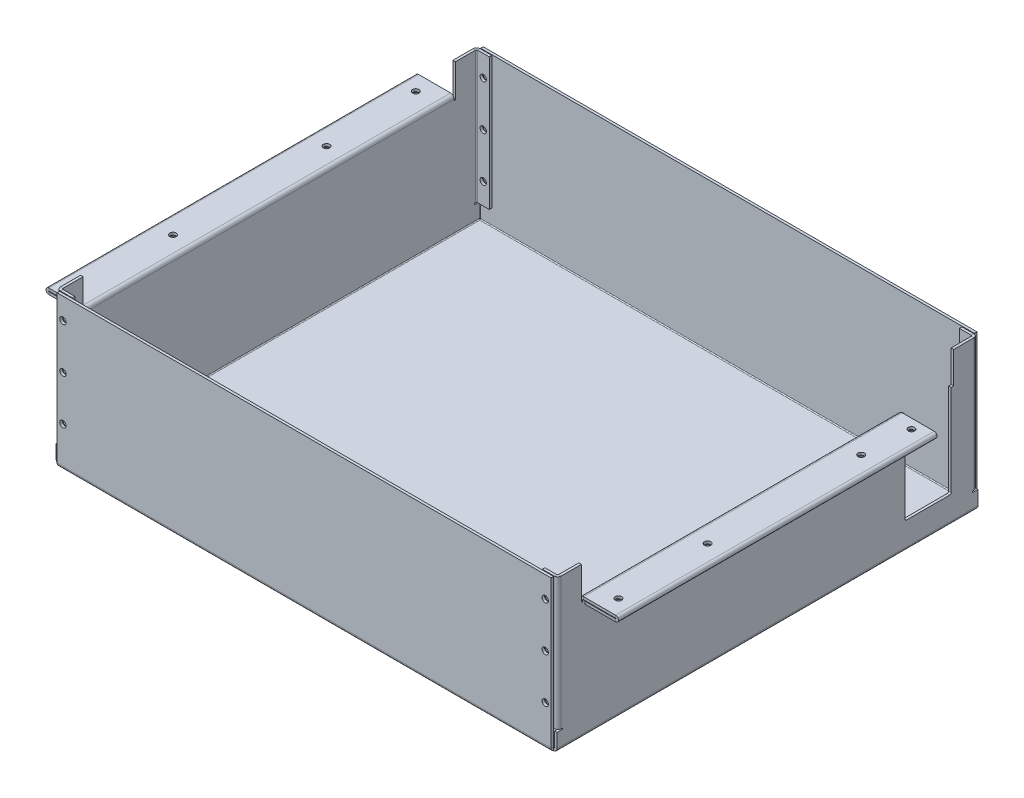
from build123d import *

# Parameters (mm, degrees)
SKETCH3_W                        = 329
SKETCH3_H                        = 116
BASE_FLANGE1_DEPTH               = 2
EDGE_FLANGE2_STRIP_W             = 9.4732
EDGE_FLANGE2_STRIP_H             = 2
EDGE_FLANGE2_STRIP_CUT_DEPTH     = 329
EDGE_FLANGE2_DEPTH               = 329
EDGE_FLANGE3_STRIP_W             = 9.4732
EDGE_FLANGE3_STRIP_H             = 2
EDGE_FLANGE3_STRIP_CUT_DEPTH     = 329
EDGE_FLANGE3_DEPTH               = 329
EDGE_FLANGE5_STRIP_W             = 9.4732
EDGE_FLANGE5_STRIP_H             = 2
EDGE_FLANGE5_STRIP_CUT_DEPTH     = 385.9268
EDGE_FLANGE5_DEPTH               = 385.9268
EDGE_FLANGE10_STRIP_W            = 9.9732
EDGE_FLANGE10_STRIP_H            = 2
EDGE_FLANGE10_STRIP_CUT_DEPTH    = 103.2634
EDGE_FLANGE10_RELIEF_W           = 10.9732
EDGE_FLANGE10_RELIEF_H           = 1
EDGE_FLANGE10_RELIEF_CUT_DEPTH   = 2
EDGE_FLANGE10_DEPTH              = 103.2634
EDGE_FLANGE11_STRIP_W            = 9.9732
EDGE_FLANGE11_STRIP_H            = 2
EDGE_FLANGE11_STRIP_CUT_DEPTH    = 103.2634
EDGE_FLANGE11_RELIEF_W           = 10.9732
EDGE_FLANGE11_RELIEF_H           = 1
EDGE_FLANGE11_RELIEF_CUT_DEPTH   = 2
EDGE_FLANGE11_DEPTH              = 103.2634
EDGE_FLANGE13_STRIP_W            = 31.4732
EDGE_FLANGE13_STRIP_H            = 2
EDGE_FLANGE13_STRIP_CUT_DEPTH    = 289
EDGE_FLANGE13_RELIEF_W           = 32.4732
EDGE_FLANGE13_RELIEF_H           = 1
EDGE_FLANGE13_RELIEF_CUT_DEPTH   = 2
EDGE_FLANGE13_STRIP_2_W          = 31.4732
EDGE_FLANGE13_STRIP_2_H          = 2
EDGE_FLANGE13_STRIP_CUT_2_DEPTH  = 249
EDGE_FLANGE13_RELIEF_2_W         = 32.4732
EDGE_FLANGE13_RELIEF_2_H         = 1
EDGE_FLANGE13_RELIEF_CUT_2_DEPTH = 2
EDGE_FLANGE13_DEPTH              = 289
EDGE_FLANGE13_BEND_DEPTH         = 249
HEM1_START                       = -144.5
HEM1_DEPTH                       = 289
HEM1_START_2                     = -104.5
HEM1_2_DEPTH                     = 249
HEM1_3_DEPTH                     = 40
SKETCH72_R                       = 2.5
CUT_EXTRUDE2_DEPTH               = 313.334260048
SKETCH73_R                       = 2.5
CUT_EXTRUDE3_DEPTH               = 313.334260048
SKETCH78_W                       = 40
SKETCH78_H                       = 24.7366
CUT_EXTRUDE4_DEPTH               = 10
CUT_EXTRUDE5_DEPTH               = 10
SKETCH80_R                       = 2.5
CUT_EXTRUDE7_DEPTH               = 419.45362945


# Read off the part's stored shape, not the designer's step: Hem1
# Sheet-metal steps are written as plain solids
with BuildPart() as part:
    # Sketch3 → Base-Flange1 (new body)
    with BuildSketch(Plane(origin=(-171.2, 0, 0), x_dir=(0, 0, -1), z_dir=(1, 0, 0))):
        Rectangle(SKETCH3_W, SKETCH3_H)
    extrude(amount=-BASE_FLANGE1_DEPTH)

    # Edge-Flange2 strip (across the edge) → Edge-Flange2 strip cut (cut)
    with BuildSketch(Plane(origin=(-171.2, -58, 164.5), x_dir=(0, 1, 0), z_dir=(0, 0, -1))):
        with Locations((-4, -1)):
            Rectangle(EDGE_FLANGE2_STRIP_W, EDGE_FLANGE2_STRIP_H)
    extrude(amount=EDGE_FLANGE2_STRIP_CUT_DEPTH, mode=Mode.SUBTRACT)

    # Edge-Flange2 section (across the edge) → Edge-Flange2 (add)
    with BuildSketch(Plane(origin=(-171.2, -58, 164.5), x_dir=(0, 1, 0), z_dir=(0, 0, -1))):
        with BuildLine():
            Line((-2, 0.7366), (-2, 387.4))
            Line((-2, 387.4), (0, 387.4))
            Line((0, 387.4), (0, 0.7366))
            ThreePointArc((0, 0.7366), (0.215745145, 0.215745145), (0.7366, 0))
            Line((0.7366, 0), (0.7366, -2))
            ThreePointArc((0.7366, -2), (-1.198468417, -1.198468417), (-2, 0.7366))
        make_face()
    extrude(amount=EDGE_FLANGE2_DEPTH)

    # Edge-Flange3 strip (across the edge) → Edge-Flange3 strip cut (cut)
    with BuildSketch(Plane(origin=(216.2, -58, 164.5), x_dir=(-1, 0, 0), z_dir=(0, 0, -1))):
        with Locations((-4, -1)):
            Rectangle(EDGE_FLANGE3_STRIP_W, EDGE_FLANGE3_STRIP_H)
    extrude(amount=EDGE_FLANGE3_STRIP_CUT_DEPTH, mode=Mode.SUBTRACT)

    # Edge-Flange3 section (across the edge) → Edge-Flange3 (add)
    with BuildSketch(Plane(origin=(216.2, -58, 164.5), x_dir=(-1, 0, 0), z_dir=(0, 0, -1))):
        with BuildLine():
            Line((-2, 0.7366), (-2, 116))
            Line((-2, 116), (0, 116))
            Line((0, 116), (0, 0.7366))
            ThreePointArc((0, 0.7366), (0.215745145, 0.215745145), (0.7366, 0))
            Line((0.7366, 0), (0.7366, -2))
            ThreePointArc((0.7366, -2), (-1.198468417, -1.198468417), (-2, 0.7366))
        make_face()
    extrude(amount=EDGE_FLANGE3_DEPTH)

    # Edge-Flange5 strip (across the edge) → Edge-Flange5 strip cut (cut)
    with BuildSketch(Plane(origin=(-170.4634, -58, 164.5), x_dir=(0, 0, -1), z_dir=(1, 0, 0))):
        with Locations((-4, -1)):
            Rectangle(EDGE_FLANGE5_STRIP_W, EDGE_FLANGE5_STRIP_H)
    edge_flange5_strip_cut = extrude(amount=EDGE_FLANGE5_STRIP_CUT_DEPTH, mode=Mode.SUBTRACT)

    # Edge-Flange5 section (across the edge) → Edge-Flange5 (add)
    with BuildSketch(Plane(origin=(-170.4634, -58, 164.5), x_dir=(0, 0, -1), z_dir=(1, 0, 0))):
        with BuildLine():
            Line((-2, 0.7366), (-2, 116))
            Line((-2, 116), (0, 116))
            Line((0, 116), (0, 0.7366))
            ThreePointArc((0, 0.7366), (0.215745145, 0.215745145), (0.7366, 0))
            Line((0.7366, 0), (0.7366, -2))
            ThreePointArc((0.7366, -2), (-1.198468417, -1.198468417), (-2, 0.7366))
        make_face()
    edge_flange5 = extrude(amount=EDGE_FLANGE5_DEPTH)

    # Mirror1: Edge-Flange5 strip cut, Edge-Flange5 across plane
    add(edge_flange5_strip_cut.mirror(Plane.XY), mode=Mode.SUBTRACT)
    add(edge_flange5.mirror(Plane.XY))

    # Edge-Flange10 strip (across the edge) → Edge-Flange10 strip cut (cut)
    with BuildSketch(Plane(origin=(216.2, -45.2634, 164), x_dir=(0, 0, -1), z_dir=(0, 1, 0))):
        with Locations((-2.25, -1)):
            Rectangle(EDGE_FLANGE10_STRIP_W, EDGE_FLANGE10_STRIP_H)
    edge_flange10_strip_cut = extrude(amount=EDGE_FLANGE10_STRIP_CUT_DEPTH, mode=Mode.SUBTRACT)

    # Edge-Flange10 relief (on the sheet) → Edge-Flange10 relief cut (cut)
    with BuildSketch(Plane(origin=(216.2, -45.2634, 161.2634), x_dir=(0, 0, -1), z_dir=(-1, 0, 0))):
        with Locations((-4.4866, 0.5)):
            Rectangle(EDGE_FLANGE10_RELIEF_W, EDGE_FLANGE10_RELIEF_H)
    edge_flange10_relief_cut = extrude(amount=-EDGE_FLANGE10_RELIEF_CUT_DEPTH, mode=Mode.SUBTRACT)

    # Edge-Flange10 section (across the edge) → Edge-Flange10 (add)
    with BuildSketch(Plane(origin=(216.2, -45.2634, 164), x_dir=(0, 0, -1), z_dir=(0, 1, 0))):
        with BuildLine():
            Line((0, 0.7366), (0, 10))
            Line((0, 10), (2, 10))
            Line((2, 10), (2, 0.7366))
            ThreePointArc((2, 0.7366), (2.215745145, 0.215745145), (2.7366, 0))
            Line((2.7366, 0), (2.7366, -2))
            ThreePointArc((2.7366, -2), (0.801531583, -1.198468417), (0, 0.7366))
        make_face()
    edge_flange10 = extrude(amount=EDGE_FLANGE10_DEPTH)

    # Mirror3: Edge-Flange10 strip cut, Edge-Flange10 relief cut, Edge-Flange10 across plane
    add(edge_flange10_strip_cut.mirror(Plane.XY), mode=Mode.SUBTRACT)
    add(edge_flange10_relief_cut.mirror(Plane.XY), mode=Mode.SUBTRACT)
    add(edge_flange10.mirror(Plane.XY))

    # Edge-Flange11 strip (across the edge) → Edge-Flange11 strip cut (cut)
    with BuildSketch(Plane(origin=(-171.2, -45.2634, -164), x_dir=(0, 0, 1), z_dir=(0, 1, 0))):
        with Locations((-2.25, -1)):
            Rectangle(EDGE_FLANGE11_STRIP_W, EDGE_FLANGE11_STRIP_H)
    edge_flange11_strip_cut = extrude(amount=EDGE_FLANGE11_STRIP_CUT_DEPTH, mode=Mode.SUBTRACT)

    # Edge-Flange11 relief (on the sheet) → Edge-Flange11 relief cut (cut)
    with BuildSketch(Plane(origin=(-171.2, -45.2634, -161.2634), x_dir=(0, 0, 1), z_dir=(1, 0, 0))):
        with Locations((-4.4866, 0.5)):
            Rectangle(EDGE_FLANGE11_RELIEF_W, EDGE_FLANGE11_RELIEF_H)
    edge_flange11_relief_cut = extrude(amount=-EDGE_FLANGE11_RELIEF_CUT_DEPTH, mode=Mode.SUBTRACT)

    # Edge-Flange11 section (across the edge) → Edge-Flange11 (add)
    with BuildSketch(Plane(origin=(-171.2, -45.2634, -164), x_dir=(0, 0, 1), z_dir=(0, 1, 0))):
        with BuildLine():
            Line((0, 0.7366), (0, 10))
            Line((0, 10), (2, 10))
            Line((2, 10), (2, 0.7366))
            ThreePointArc((2, 0.7366), (2.215745145, 0.215745145), (2.7366, 0))
            Line((2.7366, 0), (2.7366, -2))
            ThreePointArc((2.7366, -2), (0.801531583, -1.198468417), (0, 0.7366))
        make_face()
    edge_flange11 = extrude(amount=EDGE_FLANGE11_DEPTH)

    # Mirror4: Edge-Flange11 strip cut, Edge-Flange11 relief cut, Edge-Flange11 across plane
    add(edge_flange11_strip_cut.mirror(Plane.XY), mode=Mode.SUBTRACT)
    add(edge_flange11_relief_cut.mirror(Plane.XY), mode=Mode.SUBTRACT)
    add(edge_flange11.mirror(Plane.XY))

    # Edge-Flange13 strip (across the edge) → Edge-Flange13 strip cut (cut)
    with BuildSketch(Plane(origin=(-173.2, 36, 144.5), x_dir=(0, -1, 0), z_dir=(0, 0, -1))):
        with Locations((-13, -1)):
            Rectangle(EDGE_FLANGE13_STRIP_W, EDGE_FLANGE13_STRIP_H)
    extrude(amount=EDGE_FLANGE13_STRIP_CUT_DEPTH, mode=Mode.SUBTRACT)

    # Edge-Flange13 relief (on the sheet) → Edge-Flange13 relief cut (cut)
    with BuildSketch(Plane(origin=(-173.2, 33.2634, 144.5), x_dir=(0, -1, 0), z_dir=(-1, 0, 0))):
        with Locations((-15.2366, 0.5)):
            Rectangle(EDGE_FLANGE13_RELIEF_W, EDGE_FLANGE13_RELIEF_H)
        with Locations((-15.2366, -289.5)):
            Rectangle(EDGE_FLANGE13_RELIEF_W, EDGE_FLANGE13_RELIEF_H)
    extrude(amount=-EDGE_FLANGE13_RELIEF_CUT_DEPTH, mode=Mode.SUBTRACT)

    # Edge-Flange13 strip 2 (across the edge) → Edge-Flange13 strip cut 2 (cut)
    with BuildSketch(Plane(origin=(218.2, 36, -104.5), x_dir=(0, -1, 0), z_dir=(0, 0, 1))):
        with Locations((-13, -1)):
            Rectangle(EDGE_FLANGE13_STRIP_2_W, EDGE_FLANGE13_STRIP_2_H)
    extrude(amount=EDGE_FLANGE13_STRIP_CUT_2_DEPTH, mode=Mode.SUBTRACT)

    # Edge-Flange13 relief 2 (on the sheet) → Edge-Flange13 relief cut 2 (cut)
    with BuildSketch(Plane(origin=(218.2, 33.2634, -104.5), x_dir=(0, -1, 0), z_dir=(1, 0, 0))):
        with Locations((-15.2366, 0.5)):
            Rectangle(EDGE_FLANGE13_RELIEF_2_W, EDGE_FLANGE13_RELIEF_2_H)
        with Locations((-15.2366, -249.5)):
            Rectangle(EDGE_FLANGE13_RELIEF_2_W, EDGE_FLANGE13_RELIEF_2_H)
    extrude(amount=-EDGE_FLANGE13_RELIEF_CUT_2_DEPTH, mode=Mode.SUBTRACT)

    # Edge-Flange13 section (across the edge) → Edge-Flange13 (add)
    with BuildSketch(Plane(origin=(-173.2, 36, 144.5), x_dir=(0, -1, 0), z_dir=(0, 0, -1))):
        with BuildLine():
            Line((0, 0.7366), (0, 28))
            Line((0, 28), (2, 28))
            Line((2, 28), (2, 0.7366))
            ThreePointArc((2, 0.7366), (2.215745145, 0.215745145), (2.7366, 0))
            Line((2.7366, 0), (2.7366, -2))
            ThreePointArc((2.7366, -2), (0.801531583, -1.198468417), (0, 0.7366))
        make_face()
    extrude(amount=EDGE_FLANGE13_DEPTH)

    # Edge-Flange13 section 2 (across the edge) → Edge-Flange13 bend (add)
    with BuildSketch(Plane(origin=(218.2, 36, -104.5), x_dir=(0, -1, 0), z_dir=(0, 0, 1))):
        with BuildLine():
            Line((0, 0.7366), (0, 28))
            Line((0, 28), (2, 28))
            Line((2, 28), (2, 0.7366))
            ThreePointArc((2, 0.7366), (2.215745145, 0.215745145), (2.7366, 0))
            Line((2.7366, 0), (2.7366, -2))
            ThreePointArc((2.7366, -2), (0.801531583, -1.198468417), (0, 0.7366))
        make_face()
    extrude(amount=EDGE_FLANGE13_BEND_DEPTH)

    # Hem1 outline → Hem1 (cut)
    with BuildSketch(Plane.XY.offset(HEM1_START)):
        with BuildLine():
            Line((-201.2, 34), (-201.186067977, 34))
            ThreePointArc((-201.186067977, 34), (-200.45, 35.427050983), (-198.95, 36))
            Line((-198.95, 36), (-201.2, 36))
            Line((-201.2, 36), (-201.2, 34))
        make_face()
        with BuildLine():
            ThreePointArc((243.95, 36), (245.45, 35.427050983), (246.186067977, 34))
            Line((246.186067977, 34), (246.2, 34))
            Line((246.2, 34), (246.2, 36))
            Line((246.2, 36), (243.95, 36))
        make_face()
    extrude(amount=HEM1_DEPTH, mode=Mode.SUBTRACT)

    # Hem1 2 outline → Hem1 2 (add)
    with BuildSketch(Plane.XY.offset(HEM1_START_2)):
        with BuildLine():
            Line((-175.2, 31.5), (-175.2, 33.5))
            Line((-175.2, 33.5), (-198.95, 33.5))
            ThreePointArc((-198.95, 33.5), (-199.2, 33.75), (-198.95, 34))
            Line((-198.95, 34), (-201.186067977, 34))
            ThreePointArc((-201.186067977, 34), (-200.627050983, 32.25), (-198.95, 31.5))
            Line((-198.95, 31.5), (-175.2, 31.5))
        make_face()
        with BuildLine():
            Line((220.2, 33.5), (220.2, 31.5))
            Line((220.2, 31.5), (243.95, 31.5))
            ThreePointArc((243.95, 31.5), (245.627050983, 32.25), (246.186067977, 34))
            Line((246.186067977, 34), (243.95, 34))
            ThreePointArc((243.95, 34), (244.2, 33.75), (243.95, 33.5))
            Line((243.95, 33.5), (220.2, 33.5))
        make_face()
    extrude(amount=HEM1_2_DEPTH)

    # Hem1 3 outline → Hem1 3 (add)
    with BuildSketch(Plane.XY.offset(HEM1_START)):
        with BuildLine():
            Line((-175.2, 31.5), (-175.2, 33.5))
            Line((-175.2, 33.5), (-198.95, 33.5))
            ThreePointArc((-198.95, 33.5), (-199.2, 33.75), (-198.95, 34))
            Line((-198.95, 34), (-201.186067977, 34))
            ThreePointArc((-201.186067977, 34), (-200.627050983, 32.25), (-198.95, 31.5))
            Line((-198.95, 31.5), (-175.2, 31.5))
        make_face()
    extrude(amount=HEM1_3_DEPTH)

    # Sketch72 → Cut-Extrude2 (cut, through all)
    with BuildSketch(Plane(origin=(0, 36, 0), x_dir=(1, 0, 0), z_dir=(0, 1, 0))):
        with Locations((-186.4433, 60)):
            Circle(SKETCH72_R)
        with Locations((-186.4433, -60)):
            Circle(SKETCH72_R)
        with Locations((231.4433, 60)):
            Circle(SKETCH72_R)
        with Locations((231.4433, -60)):
            Circle(SKETCH72_R)
    extrude(amount=-CUT_EXTRUDE2_DEPTH, mode=Mode.SUBTRACT)

    # Sketch73 → Cut-Extrude3 (cut, through all)
    with BuildSketch(Plane(origin=(0, 36, 0), x_dir=(1, 0, 0), z_dir=(0, 1, 0))):
        with Locations((-188.7, 132)):
            Circle(SKETCH73_R)
        with Locations((233.7, -132)):
            Circle(SKETCH73_R)
        with Locations((-188.7, -132)):
            Circle(SKETCH73_R)
        with Locations((233.7, 97)):
            Circle(SKETCH73_R)
    extrude(amount=-CUT_EXTRUDE3_DEPTH, mode=Mode.SUBTRACT)

    # Sketch78 → Cut-Extrude4 (cut)
    with BuildSketch(Plane(origin=(218.2, 0, 0), x_dir=(0, 0, -1), z_dir=(1, 0, 0))):
        with Locations((125.5, 45.6317)):
            Rectangle(SKETCH78_W, SKETCH78_H)
    extrude(amount=-CUT_EXTRUDE4_DEPTH, mode=Mode.SUBTRACT)

    # Sketch79 → Cut-Extrude5 (cut)
    with BuildSketch(Plane(origin=(218.2, 0, 0), x_dir=(0, 0, -1), z_dir=(1, 0, 0))):
        with BuildLine():
            Line((107.5, 33.2634), (143.5, 33.2634))
            Line((143.5, 33.2634), (143.5, 14))
            Line((143.5, 14), (143.5, -4))
            Line((143.5, -4), (143.5, -38))
            ThreePointArc((143.5, -38), (143.207106781, -38.707106781), (142.5, -39))
            Line((142.5, -39), (108.5, -39))
            ThreePointArc((108.5, -39), (107.792893219, -38.707106781), (107.5, -38))
            Line((107.5, -38), (107.5, -4))
            Line((107.5, -4), (107.5, 14))
            Line((107.5, 14), (107.5, 33.2634))
        make_face()
    extrude(amount=-CUT_EXTRUDE5_DEPTH, mode=Mode.SUBTRACT)

    # Sketch80 → Cut-Extrude7 (cut, symmetric)
    with BuildSketch(Plane.XY.offset(166.5)):
        with Locations(Location((-165.9634, 41.3683, 0), (0, 0, 180))):
            Circle(SKETCH80_R)
        with Locations(Location((-165.9634, 6.3683, 0), (0, 0, 180))):
            Circle(SKETCH80_R)
        with Locations(Location((-165.9634, -28.6317, 0), (0, 0, 180))):
            Circle(SKETCH80_R)
    cut_extrude7 = extrude(amount=CUT_EXTRUDE7_DEPTH, both=True, mode=Mode.SUBTRACT)

    # Mirror5: Cut-Extrude7 across plane
    add(cut_extrude7.mirror(Plane(origin=(22.5, 0, 0), x_dir=(0, 0, 1), z_dir=(1, 0, 0))), mode=Mode.SUBTRACT)


solid = part.part
